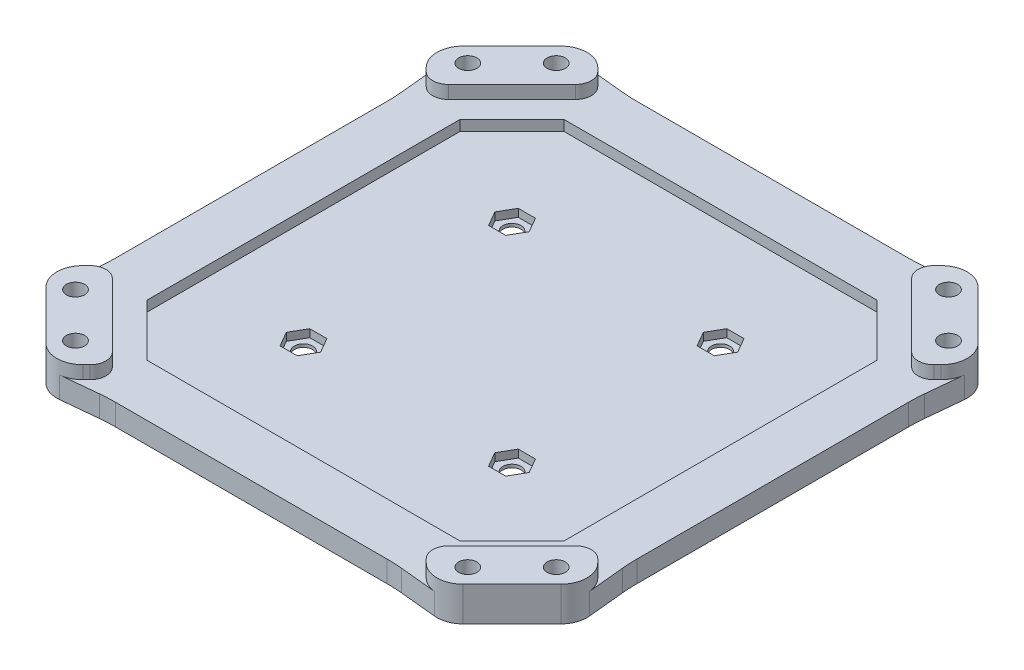
from build123d import *

# Parameters (mm, degrees)
SKETCH1_R               = 1.75
BOSS_EXTRUDE1_DEPTH     = 4.1
CUT_EXTRUDE1_DEPTH      = 2
FILLET2_R               = 30
REDONDEO2_R             = 5
CORTAR_EXTRUIR1_DEPTH   = 3.5
SIMETR_A4_COPY_1_DEPTH  = 3.5
CROQUIS2_R              = 1.75
CORTAR_EXTRUIR2_DEPTH   = 2.5
CROQUIS3_R              = 1.75
SALIENTE_EXTRUIR1_DEPTH = 2.5


with BuildPart() as part:
    # Sketch1 → Boss-Extrude1 (new body)
    with BuildSketch(Plane(origin=(0, 0, 0), x_dir=(1, 0, 0), z_dir=(0, 1, 0))):
        Polygon((-27.516424079, 50), (27.516424079, 50), (38.33273811, 51.060660172), (51.060660172, 38.33273811), (50, 27.516424079), (50, -27.516424079), (51.060660172, -38.33273811), (38.33273811, -51.060660172), (27.516424079, -50), (-27.516424079, -50), (-38.33273811, -51.060660172), (-51.060660172, -38.33273811), (-50, -27.516424079), (-50, 27.516424079), (-51.060660172, 38.33273811), (-38.33273811, 51.060660172), align=None)
        with Locations(Location((-46.110912703, 37.625631329, 0), (0, 0, 270))):
            Circle(SKETCH1_R, mode=Mode.SUBTRACT)
        with Locations(Location((-37.625631329, 46.110912703, 0), (0, 0, 270))):
            Circle(SKETCH1_R, mode=Mode.SUBTRACT)
        with Locations(Location((-37.625631329, -46.110912703, 0), (0, 0, 270))):
            Circle(SKETCH1_R, mode=Mode.SUBTRACT)
        with Locations(Location((-46.110912703, -37.625631329, 0), (0, 0, 270))):
            Circle(SKETCH1_R, mode=Mode.SUBTRACT)
        with Locations(Location((46.110912703, -37.625631329, 0), (0, 0, 270))):
            Circle(SKETCH1_R, mode=Mode.SUBTRACT)
        with Locations(Location((37.625631329, -46.110912703, 0), (0, 0, 270))):
            Circle(SKETCH1_R, mode=Mode.SUBTRACT)
        with Locations(Location((46.110912703, 37.625631329, 0), (0, 0, 270))):
            Circle(SKETCH1_R, mode=Mode.SUBTRACT)
        with Locations(Location((37.625631329, 46.110912703, 0), (0, 0, 270))):
            Circle(SKETCH1_R, mode=Mode.SUBTRACT)
    extrude(amount=BOSS_EXTRUDE1_DEPTH)

    # Sketch2 → Cut-Extrude1 (cut)
    with BuildSketch(Plane(origin=(0, 4.1, 0), x_dir=(1, 0, 0), z_dir=(0, 1, 0))):
        Polygon((-40, -30), (-40, 30), (-30, 40), (30, 40), (40, 30), (40, -30), (30, -40), (-30, -40), align=None)
    extrude(amount=-CUT_EXTRUDE1_DEPTH, mode=Mode.SUBTRACT)

    # Fillet2
    # the kernel refuses this fillet: 30 mm, written as the material it adds along each edge
    with BuildSketch(Plane(origin=(27.516424079, 0, -50), x_dir=(-1, 0, 0), z_dir=(0, 1, 0)), Plane(origin=(50, 0, -27.516424079), x_dir=(0.09759304388656845, 0, -0.9952264052892459), z_dir=(0, 1, 0)), Plane(origin=(50, 0, 27.516424079), x_dir=(0, 0, -1), z_dir=(0, 1, 0)), Plane(origin=(27.516424079, 0, 50), x_dir=(0.9952264052892461, 0, 0.09759304388656681), z_dir=(0, 1, 0)), Plane(origin=(-27.516424079, 0, 50), x_dir=(1, 0, 0), z_dir=(0, 1, 0)), Plane(origin=(-50, 0, 27.516424079), x_dir=(-0.09759304388656528, 0, 0.9952264052892461), z_dir=(0, 1, 0)), Plane(origin=(-50, 0, -27.516424079), x_dir=(0, 0, 1), z_dir=(0, 1, 0))) as fillet2_piece_1:
        with BuildLine():
            CenterArc((FILLET2_R * 0.048913268002, -FILLET2_R), FILLET2_R, 90, 5.600584003)
            Line((-FILLET2_R * 0.0486797758846, -FILLET2_R * 0.00477359471075), (0, 0))
            Line((0, 0), (FILLET2_R * 0.048913268002, 0))
        make_face()
    extrude(amount=4.1)
    with BuildSketch(Plane(origin=(-27.516424079, 0, -50), x_dir=(1, 0, 0), z_dir=(0, 1, 0))) as fillet2_piece_2:
        with BuildLine():
            CenterArc((FILLET2_R * 0.048913268002, FILLET2_R), FILLET2_R, 264.399415997, 5.600584003)
            Line((-FILLET2_R * 0.0486797758846, FILLET2_R * 0.00477359471075), (0, 0))
            Line((0, 0), (FILLET2_R * 0.048913268002, 0))
        make_face()
    extrude(amount=4.1)

    # Redondeo2
    redondeo2_edges = [part.edges().sort_by_distance(p)[0] for p in [
        (38.33273811, 2.05, -51.060660172),
        (51.060660172, 2.05, -38.33273811),
        (51.060660172, 2.05, 38.33273811),
        (38.33273811, 2.05, 51.060660172),
        (-38.33273811, 2.05, 51.060660172),
        (-51.060660172, 2.05, 38.33273811),
        (-51.060660172, 2.05, -38.33273811),
        (-38.33273811, 2.05, -51.060660172),
    ]]
    fillet(redondeo2_edges, radius=REDONDEO2_R)

    # Croquis1 → Cortar-Extruir1 (cut)
    with BuildSketch(Plane(origin=(0, 4.1, 0), x_dir=(1, 0, 0), z_dir=(0, 1, 0))):
        Polygon((-18.354551733, -17.15), (-16.709103466, -20), (-18.354551733, -22.85), (-21.645448267, -22.85), (-23.290896534, -20), (-21.645448267, -17.15), align=None)
    cortar_extruir1 = extrude(amount=-CORTAR_EXTRUIR1_DEPTH, mode=Mode.SUBTRACT)

    # Simetría3: Cortar-Extruir1 across plane
    add(cortar_extruir1.mirror(Plane(origin=(0, 0, 0), x_dir=(0, 0, 1), z_dir=(1, 0, 0))), mode=Mode.SUBTRACT)

    # Simetría4: Cortar-Extruir1 across plane
    add(cortar_extruir1.mirror(Plane.XY), mode=Mode.SUBTRACT)

    # Simetría4 copy 1 sketch → Simetría4 copy 1 (cut)
    with BuildSketch(Plane(origin=(0, 4.1, 0), x_dir=(-1, 0, 0), z_dir=(0, 1, 0))):
        Polygon((-18.354551733, -17.15), (-16.709103466, -20), (-18.354551733, -22.85), (-21.645448267, -22.85), (-23.290896534, -20), (-21.645448267, -17.15), align=None)
    extrude(amount=-SIMETR_A4_COPY_1_DEPTH, mode=Mode.SUBTRACT)

    # Croquis2 → Cortar-Extruir2 (cut)
    with BuildSketch(Plane(origin=(0, 2.1, 0), x_dir=(1, 0, 0), z_dir=(0, 1, 0))):
        with Locations(Location((-20, -20, 0), (0, 0, 270))):
            Circle(CROQUIS2_R)
        with Locations(Location((-20, 20, 0), (0, 0, 270))):
            Circle(CROQUIS2_R)
        with Locations(Location((20, 20, 0), (0, 0, 270))):
            Circle(CROQUIS2_R)
        with Locations(Location((20, -20, 0), (0, 0, 270))):
            Circle(CROQUIS2_R)
    extrude(amount=-CORTAR_EXTRUIR2_DEPTH, mode=Mode.SUBTRACT)

    # Croquis3 → Saliente-Extruir1 (add)
    # profile 1 of 4: a face of its own
    with BuildSketch(Plane(origin=(0, 4.1, 0), x_dir=(1, 0, 0), z_dir=(0, 1, 0))):
        with BuildLine():
            Line((-49.389398906, 32.932931564), (-48.682292125, 32.225824783))
            ThreePointArc((-48.682292125, 32.225824783), (-46.560971781, 31.347145126), (-44.439651438, 32.225824783))
            Line((-44.439651438, 32.225824783), (-32.225824783, 44.439651438))
            ThreePointArc((-32.225824783, 44.439651438), (-31.347145126, 46.560971781), (-32.225824783, 48.682292125))
            Line((-32.225824783, 48.682292125), (-32.932931564, 49.389398906))
            ThreePointArc((-32.932931564, 49.389398906), (-36.46846547, 50.853865), (-40.003999376, 49.389398906))
            Line((-40.003999376, 49.389398906), (-49.389398906, 40.003999376))
            ThreePointArc((-49.389398906, 40.003999376), (-50.853865, 36.46846547), (-49.389398906, 32.932931564))
        make_face()
        with Locations(Location((-37.625631329, 46.110912703, 0), (0, 0, 270))):
            Circle(CROQUIS3_R, mode=Mode.SUBTRACT)
        with Locations(Location((-46.110912703, 37.625631329, 0), (0, 0, 270))):
            Circle(CROQUIS3_R, mode=Mode.SUBTRACT)
    # profile 2 of 4: a face of its own
    with BuildSketch(Plane(origin=(0, 4.1, 0), x_dir=(1, 0, 0), z_dir=(0, 1, 0))):
        with BuildLine():
            Line((-40.003999376, -49.389398906), (-49.389398906, -40.003999376))
            ThreePointArc((-49.389398906, -40.003999376), (-50.853865, -36.46846547), (-49.389398906, -32.932931564))
            Line((-49.389398906, -32.932931564), (-48.682292125, -32.225824783))
            ThreePointArc((-48.682292125, -32.225824783), (-46.560971781, -31.347145126), (-44.439651438, -32.225824783))
            Line((-44.439651438, -32.225824783), (-32.225824783, -44.439651438))
            ThreePointArc((-32.225824783, -44.439651438), (-31.347145126, -46.560971781), (-32.225824783, -48.682292125))
            Line((-32.225824783, -48.682292125), (-32.932931564, -49.389398906))
            ThreePointArc((-32.932931564, -49.389398906), (-36.46846547, -50.853865), (-40.003999376, -49.389398906))
        make_face()
        with Locations(Location((-46.110912703, -37.625631329, 0), (0, 0, 90))):
            Circle(CROQUIS3_R, mode=Mode.SUBTRACT)
        with Locations(Location((-37.625631329, -46.110912703, 0), (0, 0, 90))):
            Circle(CROQUIS3_R, mode=Mode.SUBTRACT)
    # profile 3 of 4: a face of its own
    with BuildSketch(Plane(origin=(0, 4.1, 0), x_dir=(1, 0, 0), z_dir=(0, 1, 0))):
        with BuildLine():
            Line((40.003999376, 49.389398906), (49.389398906, 40.003999376))
            ThreePointArc((49.389398906, 40.003999376), (50.853865, 36.46846547), (49.389398906, 32.932931564))
            Line((49.389398906, 32.932931564), (48.682292125, 32.225824783))
            ThreePointArc((48.682292125, 32.225824783), (46.560971781, 31.347145126), (44.439651438, 32.225824783))
            Line((44.439651438, 32.225824783), (32.225824783, 44.439651438))
            ThreePointArc((32.225824783, 44.439651438), (31.347145126, 46.560971781), (32.225824783, 48.682292125))
            Line((32.225824783, 48.682292125), (32.932931564, 49.389398906))
            ThreePointArc((32.932931564, 49.389398906), (36.46846547, 50.853865), (40.003999376, 49.389398906))
        make_face()
        with Locations(Location((46.110912703, 37.625631329, 0), (0, 0, 90))):
            Circle(CROQUIS3_R, mode=Mode.SUBTRACT)
        with Locations(Location((37.625631329, 46.110912703, 0), (0, 0, 90))):
            Circle(CROQUIS3_R, mode=Mode.SUBTRACT)
    # profile 4 of 4: a face of its own
    with BuildSketch(Plane(origin=(0, 4.1, 0), x_dir=(1, 0, 0), z_dir=(0, 1, 0))):
        with BuildLine():
            Line((49.389398906, -32.932931564), (48.682292125, -32.225824783))
            ThreePointArc((48.682292125, -32.225824783), (46.560971781, -31.347145126), (44.439651438, -32.225824783))
            Line((44.439651438, -32.225824783), (32.225824783, -44.439651438))
            ThreePointArc((32.225824783, -44.439651438), (31.347145126, -46.560971781), (32.225824783, -48.682292125))
            Line((32.225824783, -48.682292125), (32.932931564, -49.389398906))
            ThreePointArc((32.932931564, -49.389398906), (36.46846547, -50.853865), (40.003999376, -49.389398906))
            Line((40.003999376, -49.389398906), (49.389398906, -40.003999376))
            ThreePointArc((49.389398906, -40.003999376), (50.853865, -36.46846547), (49.389398906, -32.932931564))
        make_face()
        with Locations(Location((37.625631329, -46.110912703, 0), (0, 0, 270))):
            Circle(CROQUIS3_R, mode=Mode.SUBTRACT)
        with Locations(Location((46.110912703, -37.625631329, 0), (0, 0, 270))):
            Circle(CROQUIS3_R, mode=Mode.SUBTRACT)
    extrude(amount=SALIENTE_EXTRUIR1_DEPTH)


solid = part.part
